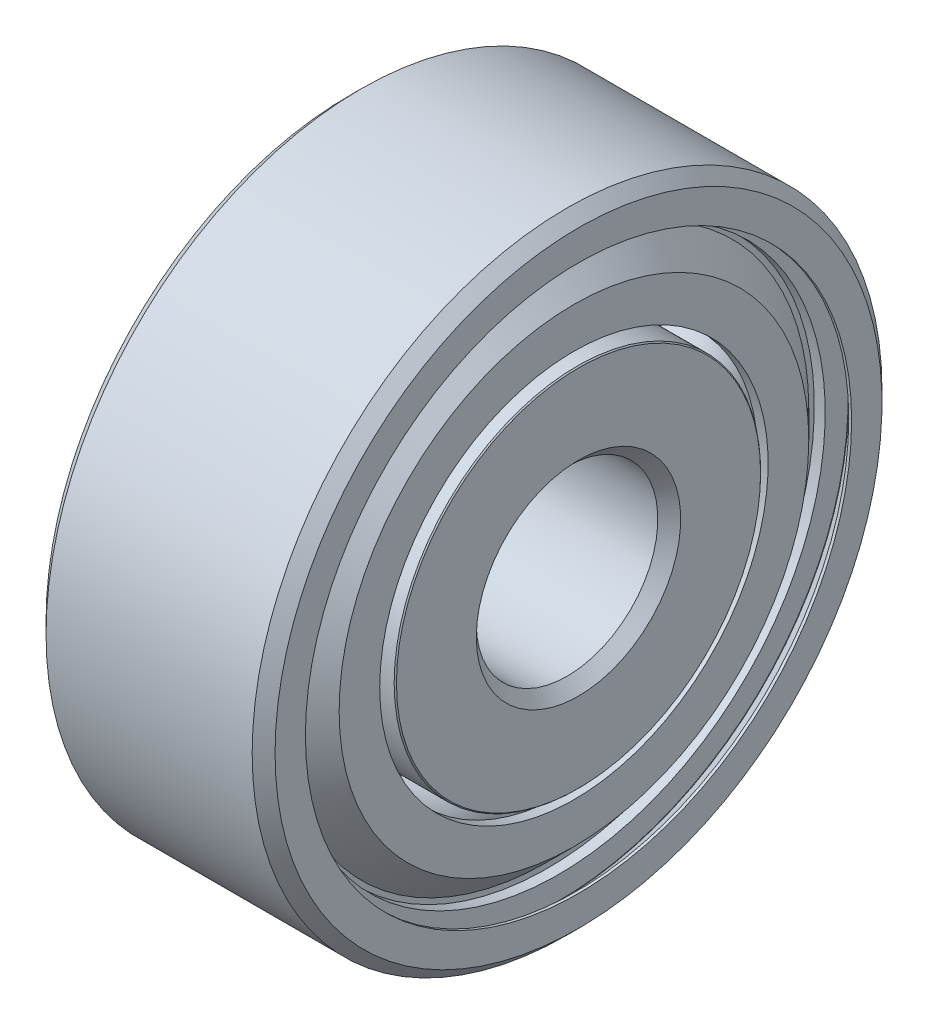
from build123d import *

# Parameters (mm, degrees)
SKETCH1_4_W       = 0.19
SKETCH1_4_H       = 0.4
CIRPATTERN2_COUNT = 8


with BuildPart() as part:
    # Sketch1 → Revolve1 (revolve)
    with BuildSketch(Plane.XY):
        with BuildLine():
            Line((-1.98, 3.2), (-2, 3.18))
            Line((-2, 3.18), (-2, 1.785))
            Line((-2, 1.785), (-1.8, 1.585))
            Line((-1.8, 1.585), (1.8, 1.585))
            Line((1.8, 1.585), (2, 1.785))
            Line((2, 1.785), (2, 3.18))
            Line((2, 3.18), (1.98, 3.2))
            Line((1.98, 3.2), (1.00871205, 3.2))
            ThreePointArc((1.00871205, 3.2), (0, 2.65), (-1.00871205, 3.2))
            Line((-1.00871205, 3.2), (-1.98, 3.2))
        make_face()
        with BuildLine():
            Line((-1.8, 5.5), (-2, 5.3))
            Line((-2, 5.3), (-2, 4.77))
            Line((-2, 4.77), (-1.95, 4.77))
            Line((-1.95, 4.77), (-1.65, 5.07))
            Line((-1.65, 5.07), (-1.45, 5.07))
            Line((-1.45, 5.07), (-1.45, 4.77))
            Line((-1.45, 4.77), (-1.25, 4.77))
            Line((-1.25, 4.77), (-1.25, 4.5))
            Line((-1.25, 4.5), (-1.00871205, 4.5))
            ThreePointArc((-1.00871205, 4.5), (0, 5.05), (1.00871205, 4.5))
            Line((1.00871205, 4.5), (1.25, 4.5))
            Line((1.25, 4.5), (1.25, 4.77))
            Line((1.25, 4.77), (1.45, 4.77))
            Line((1.45, 4.77), (1.45, 5.07))
            Line((1.45, 5.07), (1.65, 5.07))
            Line((1.65, 5.07), (1.95, 4.77))
            Line((1.95, 4.77), (2, 4.77))
            Line((2, 4.77), (2, 5.3))
            Line((2, 5.3), (1.8, 5.5))
            Line((1.8, 5.5), (-1.8, 5.5))
        make_face()
    revolve(axis=Axis((0, 0, 0), (1, 0, 0)))


with BuildPart() as body_2:
    # Sketch1<3> → Revolve2 (revolve)
    with BuildSketch(Plane.XY):
        Polygon((-1.267044482, 4.756515811), (-1.447044482, 4.756515811), (-1.447044482, 4.574558441), (-1.92036514, 4.101237783), (-1.92036514, 3.392543849), (-1.74036514, 3.392543849), (-1.74036514, 4.026679342), (-1.267044482, 4.5), align=None)
        Polygon((1.447044482, 4.756515811), (1.267044482, 4.756515811), (1.267044482, 4.5), (1.74036514, 4.026679342), (1.74036514, 3.392543849), (1.92036514, 3.392543849), (1.92036514, 4.101237783), (1.447044482, 4.574558441), align=None)
    revolve(axis=Axis((0, 0, 0), (1, 0, 0)))


with BuildPart() as body_3:
    # Sketch1<4> → Revolve3 (revolve)
    with BuildSketch(Plane.XY):
        with Locations((-1.553908134, 4.860421419)):
            Rectangle(SKETCH1_4_W, SKETCH1_4_H)
        with Locations((1.553908134, 4.860421419)):
            Rectangle(SKETCH1_4_W, SKETCH1_4_H)
    revolve(axis=Axis((0, 0, 0), (1, 0, 0)))


with BuildPart() as body_4:
    # Sketch1<5> → Revolve4 (revolve)
    with BuildSketch(Plane.XY):
        with BuildLine():
            ThreePointArc((1.15, 3.85), (0.813172798, 4.663172798), (0, 5))
            Line((0, 5), (0, 2.7))
            ThreePointArc((0, 2.7), (0.813172798, 3.036827202), (1.15, 3.85))
        make_face()
    revolve(axis=Axis((0, 5, 0), (0, -1, 0)))


with BuildPart() as cirpattern2_1:
    # CirPattern2: pattern copy
    add(body_4.part.rotate(Axis((0, 0, 0), (-1, 0, 0)), 1 * 360 / CIRPATTERN2_COUNT))


with BuildPart() as cirpattern2_2:
    # CirPattern2: pattern copy
    add(body_4.part.rotate(Axis((0, 0, 0), (-1, 0, 0)), 2 * 360 / CIRPATTERN2_COUNT))


with BuildPart() as cirpattern2_3:
    # CirPattern2: pattern copy
    add(body_4.part.rotate(Axis((0, 0, 0), (-1, 0, 0)), 3 * 360 / CIRPATTERN2_COUNT))


with BuildPart() as cirpattern2_4:
    # CirPattern2: pattern copy
    add(body_4.part.rotate(Axis((0, 0, 0), (-1, 0, 0)), 4 * 360 / CIRPATTERN2_COUNT))


with BuildPart() as cirpattern2_5:
    # CirPattern2: pattern copy
    add(body_4.part.rotate(Axis((0, 0, 0), (-1, 0, 0)), 5 * 360 / CIRPATTERN2_COUNT))


with BuildPart() as cirpattern2_6:
    # CirPattern2: pattern copy
    add(body_4.part.rotate(Axis((0, 0, 0), (-1, 0, 0)), 6 * 360 / CIRPATTERN2_COUNT))


with BuildPart() as cirpattern2_7:
    # CirPattern2: pattern copy
    add(body_4.part.rotate(Axis((0, 0, 0), (-1, 0, 0)), 7 * 360 / CIRPATTERN2_COUNT))


solid = Compound([part.part, body_2.part, body_3.part, body_4.part, cirpattern2_1.part, cirpattern2_2.part, cirpattern2_3.part, cirpattern2_4.part, cirpattern2_5.part, cirpattern2_6.part, cirpattern2_7.part])
